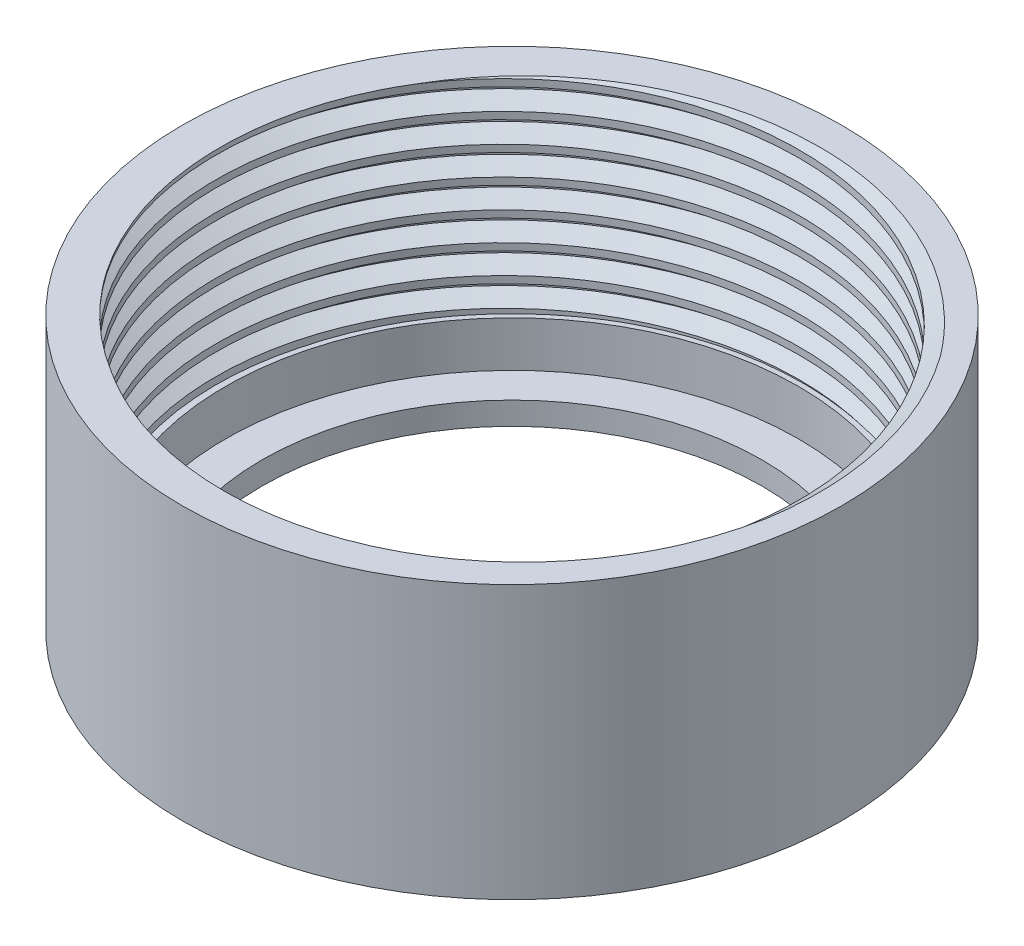
from build123d import *

# Parameters (mm, degrees)
SKETCH_1_R          = 14.5
SKETCH_1_R_2        = 11
EXTRUDE_1_DEPTH     = 1
SKETCH_2_R          = 14.5
SKETCH_2_R_2        = 12.6
EXTRUDE_2_DEPTH     = 11
SKETCH_3_R          = 13.5
CUT_EXTRUDE_1_DEPTH = 9
THREAD_1_PITCH      = 1.25
THREAD_1_FROM       = 3


with BuildPart() as part:
    # Sketch 1 → 凸台-拉伸1 (new body)
    with BuildSketch(Plane(origin=(0, 0, 0), x_dir=(1, 0, 0), z_dir=(0, 1, 0))):
        with Locations(Location((0, 0, 0), (0, 0, 270))):
            Circle(SKETCH_1_R)
        with Locations(Location((0, 0, 0), (0, 0, 270))):
            Circle(SKETCH_1_R_2, mode=Mode.SUBTRACT)
    extrude(amount=EXTRUDE_1_DEPTH)

    # 草图2 → 凸台-拉伸2 (add)
    with BuildSketch(Plane(origin=(0, 1, 0), x_dir=(1, 0, 0), z_dir=(0, 1, 0))):
        with Locations(Location((0, 0, 0), (0, 0, 270))):
            Circle(SKETCH_2_R)
        with Locations(Location((0, 0, 0), (0, 0, 270))):
            Circle(SKETCH_2_R_2, mode=Mode.SUBTRACT)
    extrude(amount=EXTRUDE_2_DEPTH)

    # 草图3 → 切除-拉伸1 (cut)
    with BuildSketch(Plane(origin=(0, 12, 0), x_dir=(1, 0, 0), z_dir=(0, 1, 0))):
        with Locations(Location((0, 0, 0), (0, 0, 270))):
            Circle(SKETCH_3_R)
    extrude(amount=-CUT_EXTRUDE_1_DEPTH, mode=Mode.SUBTRACT)

    # 螺纹线1: arcs per turn and ends read off the stored shape
    # 螺纹线1: the profile of Sketch 1 2 profile screwed along a right-hand helix through 9.6 turns, 8 arcs to a turn; built about Z, then put on its axis
    thread_1_z = Axis((0, 0, 0), (0, 0, 1))
    thread_1_corners = [(13.5003, 0, -0.000173205), (13.5003, 0, 1.093923202), (12.823417656, 0, 0.703124998), (12.823417656, 0, 0.390624998)]
    with BuildLine(mode=Mode.PRIVATE) as thread_1_profile:
        Line(thread_1_corners[0], thread_1_corners[1])
        Line(thread_1_corners[1], thread_1_corners[2])
        Line(thread_1_corners[2], thread_1_corners[3])
        Line(thread_1_corners[3], thread_1_corners[0])
    thread_1_cap = Face(thread_1_profile.wire())
    thread_1_turn_angles = [0, 22.5, 45, 67.5, 90, 112.5, 135, 157.5, 180, 202.5, 225, 247.5, 270, 292.5, 315, 337.5, 360]
    thread_1_turn_weights = [1, 0.9238795325112867, 1, 0.9238795325112867, 1, 0.9238795325112867, 1, 0.9238795325112867, 1, 0.9238795325112867, 1, 0.9238795325112867, 1, 0.9238795325112867, 1, 0.9238795325112867, 1]
    thread_1_turn_rails = [Edge.make_bspline([Vector(p[0], p[1], 0).rotate(thread_1_z, thread_1_turn_angles[k]) / thread_1_turn_weights[k] + Vector(0, 0, p[2] + THREAD_1_PITCH * thread_1_turn_angles[k] / 360) for k in range(17)], [0, 0, 0, 1, 1, 2, 2, 3, 3, 4, 4, 5, 5, 6, 6, 7, 7, 8, 8, 8], 2, thread_1_turn_weights) for p in thread_1_corners]
    thread_1_turn_sides = [Face.make_surface_from_curves(thread_1_turn_rails[p[0]], thread_1_turn_rails[p[1]]) for p in [(0, 1), (1, 2), (2, 3), (3, 0)]]
    thread_1_last_angles = [3240, 3262.5, 3285, 3307.5, 3330, 3352.5, 3375, 3397.5, 3420, 3438, 3456]
    thread_1_last_weights = [1, 0.9238795325112867, 1, 0.9238795325112867, 1, 0.9238795325112867, 1, 0.9238795325112867, 1, 0.9510565162951597, 1]
    thread_1_last_rails = [Edge.make_bspline([Vector(p[0], p[1], 0).rotate(thread_1_z, thread_1_last_angles[k]) / thread_1_last_weights[k] + Vector(0, 0, p[2] + THREAD_1_PITCH * thread_1_last_angles[k] / 360) for k in range(11)], [0, 0, 0, 1, 1, 2, 2, 3, 3, 4, 4, 5, 5, 5], 2, thread_1_last_weights) for p in thread_1_corners]
    thread_1_last_sides = [Face.make_surface_from_curves(thread_1_last_rails[p[0]], thread_1_last_rails[p[1]]) for p in [(0, 1), (1, 2), (2, 3), (3, 0)]]
    thread_1 = Plane(origin=(0, 15, 0), x_dir=(-1, 0, 0), z_dir=(0, -1, 0)) * split(Solid(Shell([*[p.moved(Location((0, 0, THREAD_1_PITCH * i))) for i in range(9) for p in thread_1_turn_sides], *thread_1_last_sides, thread_1_cap, thread_1_cap.rotate(thread_1_z, 3456).moved(Location((0, 0, THREAD_1_PITCH * 3456 / 360)))])), bisect_by=Plane.XY.offset(THREAD_1_FROM), keep=Keep.TOP, mode=Mode.PRIVATE)
    add(thread_1)


solid = part.part
